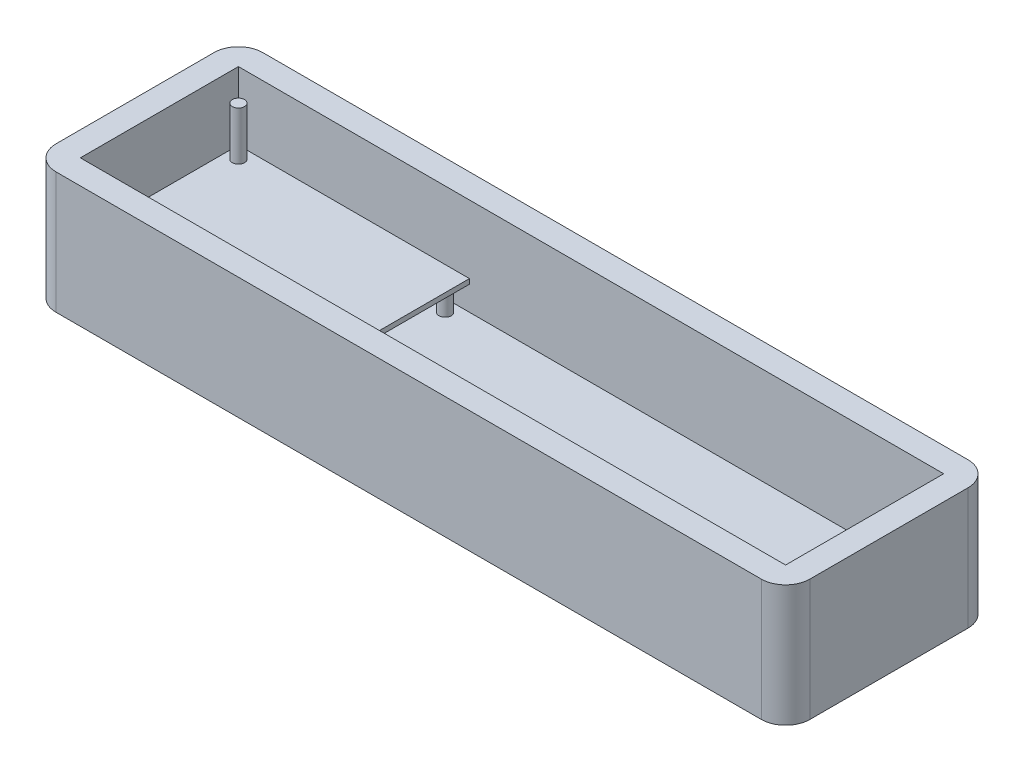
from build123d import *

# Parameters (mm, degrees)
SKIZZE2_W                       = 310
SKIZZE2_H                       = 50
AUFSATZ_LINEAR_AUSTRAGEN1_DEPTH = 85
SKIZZE4_W                       = 290
SKIZZE4_H                       = 65
SCHNITT_LINEAR_AUSTRAGEN1_DEPTH = 40
SKIZZE5_R                       = 2.5
AUFSATZ_LINEAR_AUSTRAGEN3_DEPTH = 10
SKIZZE6_W                       = 95
SKIZZE6_H                       = 65
AUFSATZ_LINEAR_AUSTRAGEN4_DEPTH = 2
SKIZZE7_R                       = 2.5
AUFSATZ_LINEAR_AUSTRAGEN5_DEPTH = 20
SKIZZE8_R                       = 2.5
AUFSATZ_LINEAR_AUSTRAGEN6_DEPTH = 30
VERRUNDUNG1_R                   = 10
VERRUNDUNG2_R                   = 10
VERRUNDUNG3_R                   = 10
VERRUNDUNG4_R                   = 10


with BuildPart() as part:
    # Skizze2 → Aufsatz-Linear austragen1 (new body)
    with BuildSketch(Plane.XY):
        with Locations((155, 25)):
            Rectangle(SKIZZE2_W, SKIZZE2_H)
    extrude(amount=AUFSATZ_LINEAR_AUSTRAGEN1_DEPTH)

    # Skizze4 → Schnitt-Linear austragen1 (cut)
    with BuildSketch(Plane(origin=(0, 50, 0), x_dir=(1, 0, 0), z_dir=(0, 1, 0))):
        with Locations((155, -42.5)):
            Rectangle(SKIZZE4_W, SKIZZE4_H)
    extrude(amount=-SCHNITT_LINEAR_AUSTRAGEN1_DEPTH, mode=Mode.SUBTRACT)

    # Skizze5 → Aufsatz-Linear austragen3 (add)
    with BuildSketch(Plane(origin=(0, 10, 0), x_dir=(1, 0, 0), z_dir=(0, 1, 0))):
        with Locations((15, -15)):
            Circle(SKIZZE5_R)
        with Locations((15, -70)):
            Circle(SKIZZE5_R)
        with Locations((100, -70)):
            Circle(SKIZZE5_R)
        with Locations((100, -15)):
            Circle(SKIZZE5_R)
    extrude(amount=AUFSATZ_LINEAR_AUSTRAGEN3_DEPTH)

    # Skizze6 → Aufsatz-Linear austragen4 (add)
    with BuildSketch(Plane(origin=(0, 20, 0), x_dir=(1, 0, 0), z_dir=(0, 1, 0))):
        with Locations((57.5, -42.5)):
            Rectangle(SKIZZE6_W, SKIZZE6_H)
    extrude(amount=AUFSATZ_LINEAR_AUSTRAGEN4_DEPTH)

    # Skizze7 → Aufsatz-Linear austragen5 (add)
    with BuildSketch(Plane(origin=(0, 22, 0), x_dir=(1, 0, 0), z_dir=(0, 1, 0))):
        with Locations((15, -15)):
            Circle(SKIZZE7_R)
        with Locations((15, -70)):
            Circle(SKIZZE7_R)
    extrude(amount=AUFSATZ_LINEAR_AUSTRAGEN5_DEPTH)

    # Skizze8 → Aufsatz-Linear austragen6 (add)
    with BuildSketch(Plane(origin=(0, 10, 0), x_dir=(1, 0, 0), z_dir=(0, 1, 0))):
        with Locations((295, -15)):
            Circle(SKIZZE8_R)
        with Locations((295, -70)):
            Circle(SKIZZE8_R)
    extrude(amount=AUFSATZ_LINEAR_AUSTRAGEN6_DEPTH)

    # Verrundung1
    verrundung1_edges = [part.edges().sort_by_distance(p)[0] for p in [
        (310, 25, 0),
    ]]
    fillet(verrundung1_edges, radius=VERRUNDUNG1_R)

    # Verrundung2
    verrundung2_edges = [part.edges().sort_by_distance(p)[0] for p in [
        (310, 25, 85),
    ]]
    fillet(verrundung2_edges, radius=VERRUNDUNG2_R)

    # Verrundung3
    verrundung3_edges = [part.edges().sort_by_distance(p)[0] for p in [
        (0, 25, 85),
    ]]
    fillet(verrundung3_edges, radius=VERRUNDUNG3_R)

    # Verrundung4
    verrundung4_edges = [part.edges().sort_by_distance(p)[0] for p in [
        (0, 25, 0),
    ]]
    fillet(verrundung4_edges, radius=VERRUNDUNG4_R)


solid = part.part
